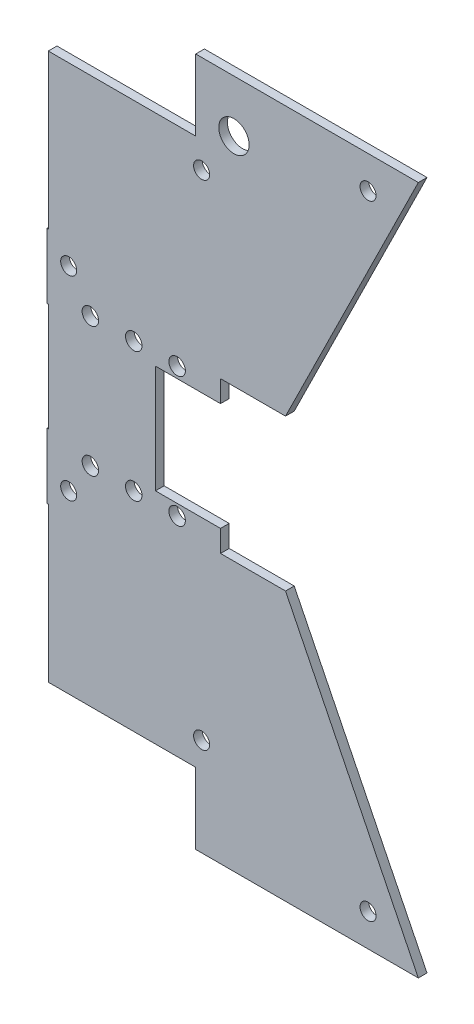
from build123d import *

# Parameters (mm, degrees)
SKETCH1_R           = 2.3495
SKETCH1_R_2         = 4.445
BOSS_EXTRUDE1_DEPTH = 2.54
SKETCH2_R           = 2.413
CUT_EXTRUDE1_DEPTH  = 217.884748371
SKETCH3_W           = 19.05
SKETCH3_H           = 31.623
CUT_EXTRUDE2_DEPTH  = 217.884748371
SKETCH4_W           = 12.77569874
SKETCH4_H           = 24.435209008
SKETCH4_W_2         = 40.233428475
SKETCH4_H_2         = 28.333759116
CUT_EXTRUDE3_DEPTH  = 217.884748371


with BuildPart() as part:
    # Sketch1 → Boss-Extrude1 (new body)
    with BuildSketch(Plane.XY):
        Polygon((-2.930050059, -104.509781075), (-3.314938219, -104.509781075), (-3.314938219, -110.859781075), (-3.314938219, -123.559781075), (-2.930050059, -123.559781075), (-2.930050059, -168.708281075), (38.709428475, -168.708281075), (38.709428475, -189.536281075), (105.397061781, -189.536281075), (66.517436481, -110.859781075), (47.485061781, -110.859781075), (47.485061781, -104.509781075), (47.485061781, -72.886781075), (47.485061781, -66.536781075), (66.517436481, -66.536781075), (105.397061781, 12.139718925), (38.709428475, 12.139718925), (38.709428475, -8.688281075), (-2.930050059, -8.688281075), (-2.930050059, -53.836781075), (-3.314938219, -53.836781075), (-3.314938219, -66.536781075), (-3.314938219, -72.886781075), (-2.930050059, -72.886781075), align=None)
        with Locations((90.673911143, 2.614718925)):
            Circle(SKETCH1_R, mode=Mode.SUBTRACT)
        with Locations((41.95655448, -16.435281075)):
            Circle(SKETCH1_R, mode=Mode.SUBTRACT)
        with Locations((3.035061781, -60.186781075)):
            Circle(SKETCH1_R, mode=Mode.SUBTRACT)
        with Locations((3.035061781, -117.209781075)):
            Circle(SKETCH1_R, mode=Mode.SUBTRACT)
        with Locations((41.95655448, -160.961281075)):
            Circle(SKETCH1_R, mode=Mode.SUBTRACT)
        with Locations((90.673911143, -180.011281075)):
            Circle(SKETCH1_R, mode=Mode.SUBTRACT)
        with Locations((51.409428475, -3.100281075)):
            Circle(SKETCH1_R_2, mode=Mode.SUBTRACT)
    extrude(amount=BOSS_EXTRUDE1_DEPTH)

    # Sketch2 → Cut-Extrude1 (cut, through all)
    with BuildSketch(Plane.XY.offset(2.54)):
        with Locations((9.385061781, -69.711781075)):
            Circle(SKETCH2_R)
        with Locations((22.085061781, -69.711781075)):
            Circle(SKETCH2_R)
        with Locations((34.785061781, -69.711781075)):
            Circle(SKETCH2_R)
        with Locations((34.785061781, -107.684781075)):
            Circle(SKETCH2_R)
        with Locations((22.085061781, -107.684781075)):
            Circle(SKETCH2_R)
        with Locations((9.385061781, -107.684781075)):
            Circle(SKETCH2_R)
    extrude(amount=-CUT_EXTRUDE1_DEPTH, mode=Mode.SUBTRACT)

    # Sketch3 → Cut-Extrude2 (cut, through all)
    with BuildSketch(Plane.XY.offset(2.54)):
        with Locations((37.960061781, -88.698281075)):
            Rectangle(SKETCH3_W, SKETCH3_H)
    extrude(amount=-CUT_EXTRUDE2_DEPTH, mode=Mode.SUBTRACT)

    # Sketch4 → Cut-Extrude3 (cut, through all)
    with BuildSketch(Plane.XY.offset(2.54)):
        with Locations((33.845579105, 3.529323429)):
            Rectangle(SKETCH4_W, SKETCH4_H)
        with Locations((20.116714238, -182.875160633)):
            Rectangle(SKETCH4_W_2, SKETCH4_H_2)
    extrude(amount=-CUT_EXTRUDE3_DEPTH, mode=Mode.SUBTRACT)


solid = part.part
